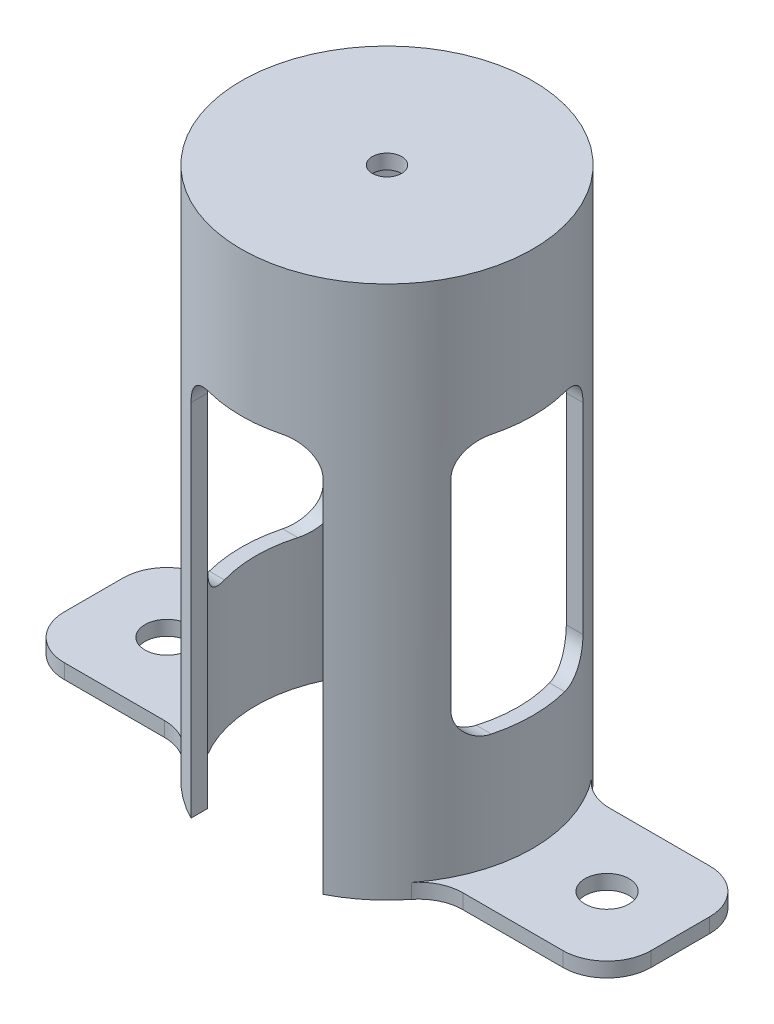
from build123d import *

# Parameters (mm, degrees)
SKETCH2_R           = 9.9375
BOSS_EXTRUDE1_DEPTH = 35.384
SKETCH4_R           = 1
CUT_EXTRUDE2_DEPTH  = 39.072762817
BOSS_EXTRUDE2_START = 1
SKETCH11_R          = 8.9375
BOSS_EXTRUDE2_DEPTH = 1
SKETCH12_R          = 8.9375
CUT_EXTRUDE7_DEPTH  = 34.384
CUT_EXTRUDE8_START  = -1
CUT_EXTRUDE8_DEPTH  = 26.538
SKETCH14_W          = 9
SKETCH14_H          = 17.692
CUT_EXTRUDE9_DEPTH  = 63.054664307
FILLET3_R           = 2
FILLET4_R           = 3
CUT_EXTRUDE10_REACH = 43.842
SKETCH15_R          = 1.5


# Read off the part's stored shape, not the designer's step: Cut-Extrude8
with BuildPart() as part:
    # Sketch2 → Boss-Extrude1 (new body)
    with BuildSketch(Plane(origin=(0, 0, 0), x_dir=(1, 0, 0), z_dir=(0, 1, 0))):
        with Locations(Location((0, 0, 0), (0, 0, 270))):
            Circle(SKETCH2_R)
    extrude(amount=BOSS_EXTRUDE1_DEPTH)

    # Sketch4 → Cut-Extrude2 (cut, through all)
    with BuildSketch(Plane(origin=(0, 35.384, 0), x_dir=(1, 0, 0), z_dir=(0, 1, 0))):
        with Locations(Location((0, 0, 0), (0, 0, 270))):
            Circle(SKETCH4_R)
    extrude(amount=-CUT_EXTRUDE2_DEPTH, mode=Mode.SUBTRACT)

    # Sketch11 → Boss-Extrude2 (add)
    with BuildSketch(Plane.XZ.offset(BOSS_EXTRUDE2_START)):
        with BuildLine():
            Line((8.588009446, 5), (20, 5))
            Line((20, 5), (20, -5))
            Line((20, -5), (8.588009446, -5))
            ThreePointArc((8.588009446, -5), (0, -9.9375), (-8.588009446, -5))
            Line((-8.588009446, -5), (-20, -5))
            Line((-20, -5), (-20, 5))
            Line((-20, 5), (-8.588009446, 5))
            ThreePointArc((-8.588009446, 5), (0, 9.9375), (8.588009446, 5))
        make_face()
        with Locations(Location((0, 0, 0), (0, 0, 270))):
            Circle(SKETCH11_R, mode=Mode.SUBTRACT)
    extrude(amount=-BOSS_EXTRUDE2_DEPTH)

    # Sketch12 → Cut-Extrude7 (cut)
    with BuildSketch(Plane.XZ):
        with Locations(Location((0, 0, 0), (0, 0, 270))):
            Circle(SKETCH12_R)
    extrude(amount=-CUT_EXTRUDE7_DEPTH, mode=Mode.SUBTRACT)

    # Cut-Extrude8 outline → Cut-Extrude8 (cut)
    with BuildSketch(Plane(origin=(0, 0, 0), x_dir=(1, 0, 0), z_dir=(0, 1, 0)).offset(CUT_EXTRUDE8_START)):
        with BuildLine():
            ThreePointArc((4.5, -7.721975541), (0, -8.9375), (-4.5, -7.721975541))
            Line((-4.5, -7.721975541), (-4.5, -8.860243013))
            ThreePointArc((-4.5, -8.860243013), (0, -9.9375), (4.5, -8.860243013))
            Line((4.5, -8.860243013), (4.5, -7.721975541))
        make_face()
        with BuildLine():
            Line((-4.5, 8.860243013), (-4.5, 7.721975541))
            ThreePointArc((-4.5, 7.721975541), (0, 8.9375), (4.5, 7.721975541))
            Line((4.5, 7.721975541), (4.5, 8.860243013))
            ThreePointArc((4.5, 8.860243013), (0, 9.9375), (-4.5, 8.860243013))
        make_face()
    extrude(amount=CUT_EXTRUDE8_DEPTH, mode=Mode.SUBTRACT)

    # Sketch14 → Cut-Extrude9 (cut, through all)
    with BuildSketch(Plane(origin=(30, 0, 0), x_dir=(0, 0, -1), z_dir=(1, 0, 0))):
        with Locations((0, 16.692)):
            Rectangle(SKETCH14_W, SKETCH14_H)
    extrude(amount=-CUT_EXTRUDE9_DEPTH, mode=Mode.SUBTRACT)

    # Fillet3
    fillet3_edges = [part.edges().sort_by_distance(p)[0] for p in [
        (4.5, 25.538, 8.291109277),
        (4.5, 25.538, -8.291109277),
        (-4.5, 25.538, -8.291109277),
        (-4.5, 25.538, 8.291109277),
        (8.291109277, 25.538, -4.5),
        (-8.291109277, 25.538, -4.5),
        (8.291109277, 7.846, -4.5),
        (-8.291109277, 7.846, -4.5),
        (-8.291109277, 7.846, 4.5),
        (8.291109277, 7.846, 4.5),
        (8.291109277, 25.538, 4.5),
        (-8.291109277, 25.538, 4.5),
    ]]
    fillet(fillet3_edges, radius=FILLET3_R)

    # Fillet4
    # the kernel refuses this fillet: 3 mm, written as the material it adds along each edge
    with BuildSketch(Plane(origin=(8.588009446, -1, -5), x_dir=(-0.562116261978449, 0, -0.8270582252897166), z_dir=(0, 1, 0)), Plane(origin=(-8.588009446, -1, 5), x_dir=(0.5621162619784511, 0, 0.8270582252897152), z_dir=(0, 1, 0))) as fillet4_piece_1:
        with BuildLine():
            CenterArc((1.593293854, -2.992714011), FILLET4_R, 93.994010432, 51.803711499)
            Line((-0.887880822, -1.306365225), (0, 0))
            ThreePointArc((0, 0), (0.692168641, -0.024134839), (1.384337283, 0))
        make_face()
    extrude(amount=1)
    with BuildSketch(Plane(origin=(8.588009446, -1, 5), x_dir=(-0.5621162619784463, 0, 0.8270582252897184), z_dir=(0, 1, 0)), Plane(origin=(-8.588009446, -1, -5), x_dir=(0.5621162619784531, 0, -0.8270582252897138), z_dir=(0, 1, 0))) as fillet4_piece_2:
        with BuildLine():
            CenterArc((1.593293854, 2.992714011), FILLET4_R, 214.20227807, 51.803711499)
            Line((-0.887880822, 1.306365225), (0, 0))
            ThreePointArc((0, 0), (0.692168641, 0.024134839), (1.384337283, 0))
        make_face()
    extrude(amount=1)
    # the kernel refuses this fillet: 3 mm, written as the material it takes off along each edge
    with BuildSketch(Plane(origin=(20, -8.5, -5), x_dir=(0, 0, 1), z_dir=(0, 1, 0)), Plane(origin=(20, -8.5, 5), x_dir=(-1, 0, 0), z_dir=(0, 1, 0))) as fillet4_2_piece_1:
        with BuildLine():
            CenterArc((FILLET4_R, -FILLET4_R), FILLET4_R, 90, 90)
            Line((0, -FILLET4_R), (0, 0))
            Line((0, 0), (FILLET4_R, 0))
        make_face()
    extrude(amount=16, mode=Mode.SUBTRACT)
    with BuildSketch(Plane(origin=(-20, -8.5, 5), x_dir=(1, 0, 0), z_dir=(0, 1, 0)), Plane(origin=(-20, -8.5, -5), x_dir=(0, 0, 1), z_dir=(0, 1, 0))) as fillet4_2_piece_2:
        with BuildLine():
            CenterArc((FILLET4_R, FILLET4_R), FILLET4_R, 180, 90)
            Line((0, FILLET4_R), (0, 0))
            Line((0, 0), (FILLET4_R, 0))
        make_face()
    extrude(amount=16, mode=Mode.SUBTRACT)

    # Sketch15 → Cut-Extrude10 (cut, up to next)
    with BuildSketch(Plane(origin=(0, 0, 0), x_dir=(1, 0, 0), z_dir=(0, 1, 0)), mode=Mode.PRIVATE) as cut_extrude10_sk1:
        with Locations(Location((-15, 0, 0), (0, 0, 270))):
            Circle(SKETCH15_R)
    cut_extrude10_tool1 = extrude(cut_extrude10_sk1.sketch, amount=-CUT_EXTRUDE10_REACH, mode=Mode.PRIVATE) & part.part
    # Sketch15 → Cut-Extrude10 (cut, up to next)
    with BuildSketch(Plane(origin=(0, 0, 0), x_dir=(1, 0, 0), z_dir=(0, 1, 0)), mode=Mode.PRIVATE) as cut_extrude10_sk2:
        with Locations(Location((15, 0, 0), (0, 0, 270))):
            Circle(SKETCH15_R)
    cut_extrude10_tool2 = extrude(cut_extrude10_sk2.sketch, amount=-CUT_EXTRUDE10_REACH, mode=Mode.PRIVATE) & part.part
    add(cut_extrude10_tool1.solids().sort_by_distance((-15, 0, 0))[0], mode=Mode.SUBTRACT)
    add(cut_extrude10_tool2.solids().sort_by_distance((15, 0, 0))[0], mode=Mode.SUBTRACT)


solid = part.part
